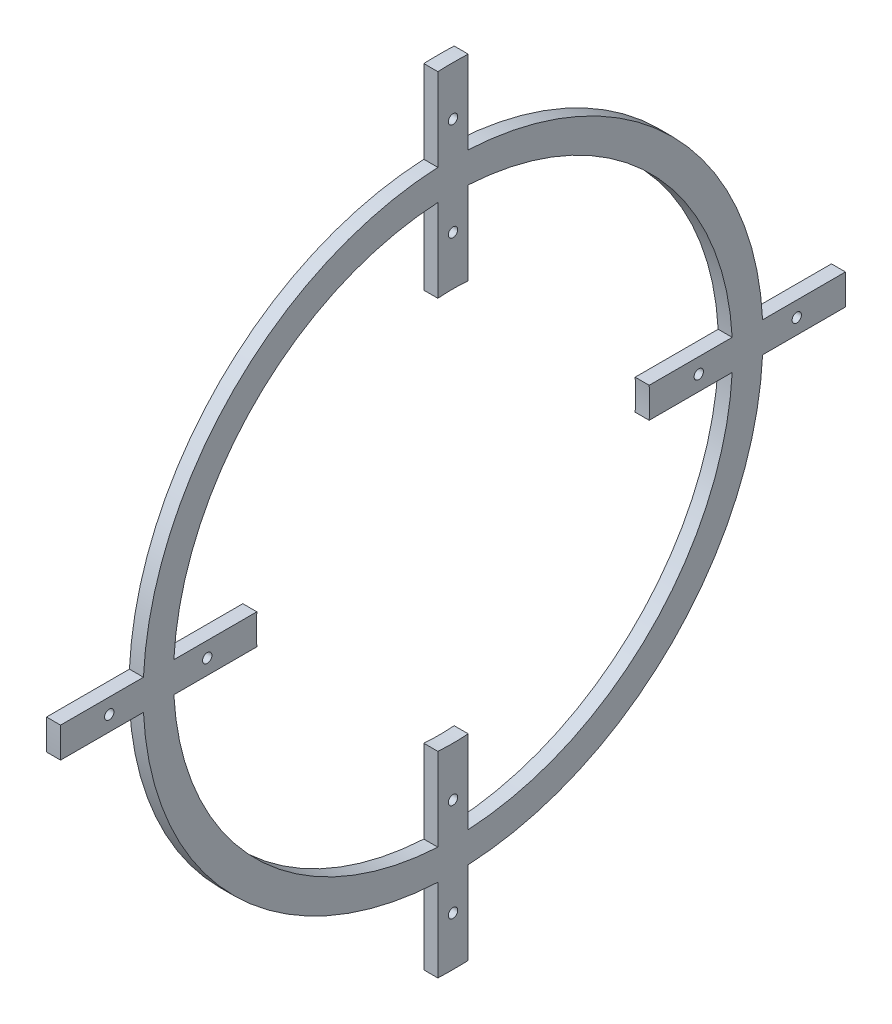
from build123d import *

# Parameters (mm, degrees)
SKETCH1_W           = 450
SKETCH1_H           = 450
BOSS_EXTRUDE1_DEPTH = 5
BOSS_EXTRUDE2_DEPTH = 7.48
BOSS_EXTRUDE3_DEPTH = 7.48
SKETCH6_W           = 450
SKETCH6_H           = 450
CUT_EXTRUDE1_DEPTH  = 5
SKETCH7_R           = 11
SKETCH7_R_2         = 2.5
CUT_EXTRUDE2_DEPTH  = 10
SKETCH8_R           = 2.5
CUT_EXTRUDE4_DEPTH  = 10


# Read off the part's stored shape, not the designer's step: Boss-Extrude2
with BuildPart() as part:
    # Sketch1 → Boss-Extrude1 (new body)
    with BuildSketch(Plane(origin=(0, 0, 0), x_dir=(0, 0, -1), z_dir=(1, 0, 0))):
        Rectangle(SKETCH1_W, SKETCH1_H)
    extrude(amount=BOSS_EXTRUDE1_DEPTH)

    # Boss-Extrude2 outline → Boss-Extrude2 (add)
    with BuildSketch(Plane(origin=(5, 0, 0), x_dir=(0, 0, -1), z_dir=(1, 0, 0))):
        with BuildLine():
            Line((-164.971757583, 8.09), (-209.152698388, 8.09))
            ThreePointArc((-209.152698388, 8.09), (-209.3091, 0), (-209.152698388, -8.09))
            Line((-209.152698388, -8.09), (-164.971757583, -8.09))
            ThreePointArc((-164.971757583, -8.09), (-116.792827049, -116.792827049), (-8.09, -164.971757583))
            Line((-8.09, -164.971757583), (-8.09, -209.152698388))
            ThreePointArc((-8.09, -209.152698388), (0, -209.3091), (8.09, -209.152698388))
            Line((8.09, -209.152698388), (8.09, -164.971757583))
            ThreePointArc((8.09, -164.971757583), (116.792827049, -116.792827049), (164.971757583, -8.09))
            Line((164.971757583, -8.09), (209.152698388, -8.09))
            ThreePointArc((209.152698388, -8.09), (209.3091, 0), (209.152698388, 8.09))
            Line((209.152698388, 8.09), (164.971757583, 8.09))
            ThreePointArc((164.971757583, 8.09), (116.792827049, 116.792827049), (8.09, 164.971757583))
            Line((8.09, 164.971757583), (8.09, 209.152698388))
            ThreePointArc((8.09, 209.152698388), (0, 209.3091), (-8.09, 209.152698388))
            Line((-8.09, 209.152698388), (-8.09, 164.971757583))
            ThreePointArc((-8.09, 164.971757583), (-116.792827049, 116.792827049), (-164.971757583, 8.09))
        make_face()
        with BuildLine():
            Line((148.770198629, 8.09), (104.538333308, 8.09))
            ThreePointArc((104.538333308, 8.09), (104.8509, 0), (104.538333308, -8.09))
            Line((104.538333308, -8.09), (148.770198629, -8.09))
            ThreePointArc((148.770198629, -8.09), (105.351839329, -105.351839329), (8.09, -148.770198629))
            Line((8.09, -148.770198629), (8.09, -104.538333308))
            ThreePointArc((8.09, -104.538333308), (0, -104.8509), (-8.09, -104.538333308))
            Line((-8.09, -104.538333308), (-8.09, -148.770198629))
            ThreePointArc((-8.09, -148.770198629), (-105.351839329, -105.351839329), (-148.770198629, -8.09))
            Line((-148.770198629, -8.09), (-104.538333308, -8.09))
            ThreePointArc((-104.538333308, -8.09), (-104.8509, 0), (-104.538333308, 8.09))
            Line((-104.538333308, 8.09), (-148.770198629, 8.09))
            ThreePointArc((-148.770198629, 8.09), (-105.351839329, 105.351839329), (-8.09, 148.770198629))
            Line((-8.09, 148.770198629), (-8.09, 104.538333308))
            ThreePointArc((-8.09, 104.538333308), (0, 104.8509), (8.09, 104.538333308))
            Line((8.09, 104.538333308), (8.09, 148.770198629))
            ThreePointArc((8.09, 148.770198629), (105.351839329, 105.351839329), (148.770198629, 8.09))
        make_face(mode=Mode.SUBTRACT)
    extrude(amount=BOSS_EXTRUDE2_DEPTH)

    # Sketch5 → Boss-Extrude3 (add)
    with BuildSketch(Plane(origin=(5, 0, 0), x_dir=(0, 0, -1), z_dir=(1, 0, 0))):
        with BuildLine():
            Line((-19.319547743, 8.09), (-104.275748565, 8.09))
            ThreePointArc((-104.275748565, 8.09), (-104.5891, 0), (-104.275748565, -8.09))
            Line((-104.275748565, -8.09), (-19.319547743, -8.09))
            ThreePointArc((-19.319547743, -8.09), (0, -20.945), (19.319547743, -8.09))
            Line((19.319547743, -8.09), (104.275748565, -8.09))
            ThreePointArc((104.275748565, -8.09), (104.5891, 0), (104.275748565, 8.09))
            Line((104.275748565, 8.09), (19.319547743, 8.09))
            ThreePointArc((19.319547743, 8.09), (0, 20.945), (-19.319547743, 8.09))
        make_face()
    extrude(amount=BOSS_EXTRUDE3_DEPTH)

    # Sketch6 → Cut-Extrude1 (cut)
    with BuildSketch(Plane.ZY):
        Rectangle(SKETCH6_W, SKETCH6_H)
    extrude(amount=-CUT_EXTRUDE1_DEPTH, mode=Mode.SUBTRACT)


with BuildPart() as cut_extrude1_piece_1:
    # of the separate pieces the step leaves, piece 1, a body of its own (cut_extrude1_pieces)
    add(part.part.solids().sort_by_distance((5, 209.152698388, 8.09))[0])


with BuildPart() as cut_extrude1_piece_2:
    # of the separate pieces the step leaves, piece 2, a body of its own (cut_extrude1_pieces)
    add(part.part.solids().sort_by_distance((5, 8.09, -104.275748565))[0])


with BuildPart() as cut_extrude2_tool:
    # Sketch7 → Cut-Extrude2 (new body)
    with BuildSketch(Plane(origin=(12.48, 0, 0), x_dir=(0, 0, -1), z_dir=(1, 0, 0))):
        Circle(SKETCH7_R)
        with Locations((-183.1891, 0)):
            Circle(SKETCH7_R_2)
        with Locations((-130.9659, 0)):
            Circle(SKETCH7_R_2)
        with Locations((0, -183.1891)):
            Circle(SKETCH7_R_2)
        with Locations((0, -130.9659)):
            Circle(SKETCH7_R_2)
        with Locations((183.1891, 0)):
            Circle(SKETCH7_R_2)
        with Locations((52.3, 0)):
            Circle(SKETCH7_R_2)
        with Locations((-52.295, 0)):
            Circle(SKETCH7_R_2)
        with Locations((0, 183.1891)):
            Circle(SKETCH7_R_2)
        with Locations((0, 130.9659)):
            Circle(SKETCH7_R_2)
        with BuildLine():
            Line((-3, 13.8), (-3, 10.583005244))
            ThreePointArc((-3, 10.583005244), (0, 11), (3, 10.583005244))
            Line((3, 10.583005244), (3, 13.8))
            Line((3, 13.8), (-3, 13.8))
        make_face()
        with Locations((130.9659, 0)):
            Circle(SKETCH7_R_2)
    extrude(amount=-CUT_EXTRUDE2_DEPTH)


with BuildPart() as cut_extrude1_piece_1_1:
    add(cut_extrude1_piece_1.part)

    # Cut-Extrude2: cut by cut_extrude2_tool
    add(cut_extrude2_tool.part, mode=Mode.SUBTRACT)


with BuildPart() as cut_extrude1_piece_2_1:
    add(cut_extrude1_piece_2.part)

    # Cut-Extrude2: cut by cut_extrude2_tool
    add(cut_extrude2_tool.part, mode=Mode.SUBTRACT)

    # Sketch8 → Cut-Extrude4 (cut)
    with BuildSketch(Plane(origin=(12.48, 0, 0), x_dir=(0, 0, -1), z_dir=(1, 0, 0))):
        with BuildLine():
            ThreePointArc((19.319547743, 8.09), (0, 20.945), (-19.319547743, 8.09))
            Line((-19.319547743, 8.09), (-104.275748565, 8.09))
            ThreePointArc((-104.275748565, 8.09), (-104.5891, 0), (-104.275748565, -8.09))
            Line((-104.275748565, -8.09), (-19.319547743, -8.09))
            ThreePointArc((-19.319547743, -8.09), (0, -20.945), (19.319547743, -8.09))
            Line((19.319547743, -8.09), (104.275748565, -8.09))
            ThreePointArc((104.275748565, -8.09), (104.5891, 0), (104.275748565, 8.09))
            Line((104.275748565, 8.09), (19.319547743, 8.09))
        make_face()
        with Locations((-52.295, 0)):
            Circle(SKETCH8_R, mode=Mode.SUBTRACT)
        with Locations((52.3, 0)):
            Circle(SKETCH8_R, mode=Mode.SUBTRACT)
        with BuildLine():
            Line((3, 13.8), (3, 10.583005244))
            ThreePointArc((3, 10.583005244), (0, -11), (-3, 10.583005244))
            Line((-3, 10.583005244), (-3, 13.8))
            Line((-3, 13.8), (3, 13.8))
        make_face(mode=Mode.SUBTRACT)
    extrude(amount=-CUT_EXTRUDE4_DEPTH, mode=Mode.SUBTRACT)


solid = cut_extrude1_piece_1_1.part
